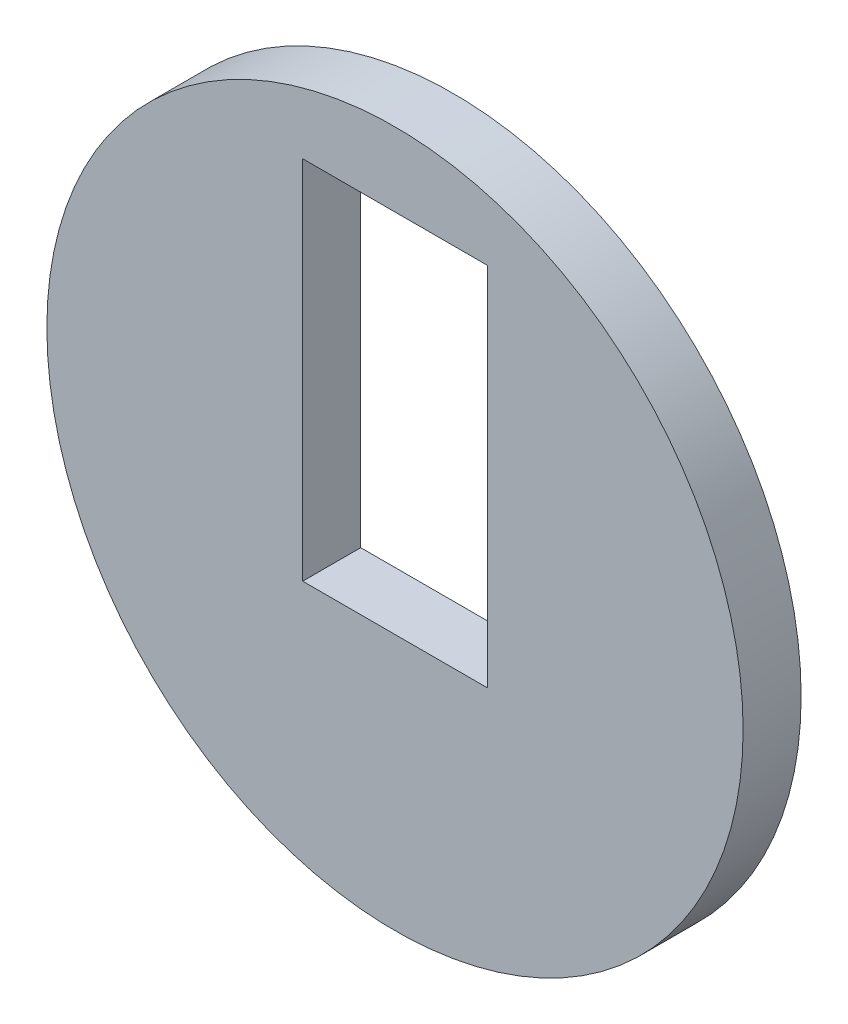
from build123d import *

# Parameters (mm, degrees)
SKETCH1_R           = 38.1
BOSS_EXTRUDE1_DEPTH = 6.35
SKETCH4_W           = 20.2
SKETCH4_H           = 40.04
CUT_EXTRUDE1_DEPTH  = 55.254423783


with BuildPart() as part:
    # Sketch1 → Boss-Extrude1 (new body)
    with BuildSketch(Plane.XY):
        Circle(SKETCH1_R)
    extrude(amount=BOSS_EXTRUDE1_DEPTH)

    # Sketch4 → Cut-Extrude1 (cut, through all)
    with BuildSketch(Plane(origin=(0, 0, 0), x_dir=(-1, 0, 0), z_dir=(0, 0, -1))):
        with Locations((0, 10)):
            Rectangle(SKETCH4_W, SKETCH4_H)
    extrude(amount=-CUT_EXTRUDE1_DEPTH, mode=Mode.SUBTRACT)


solid = part.part
